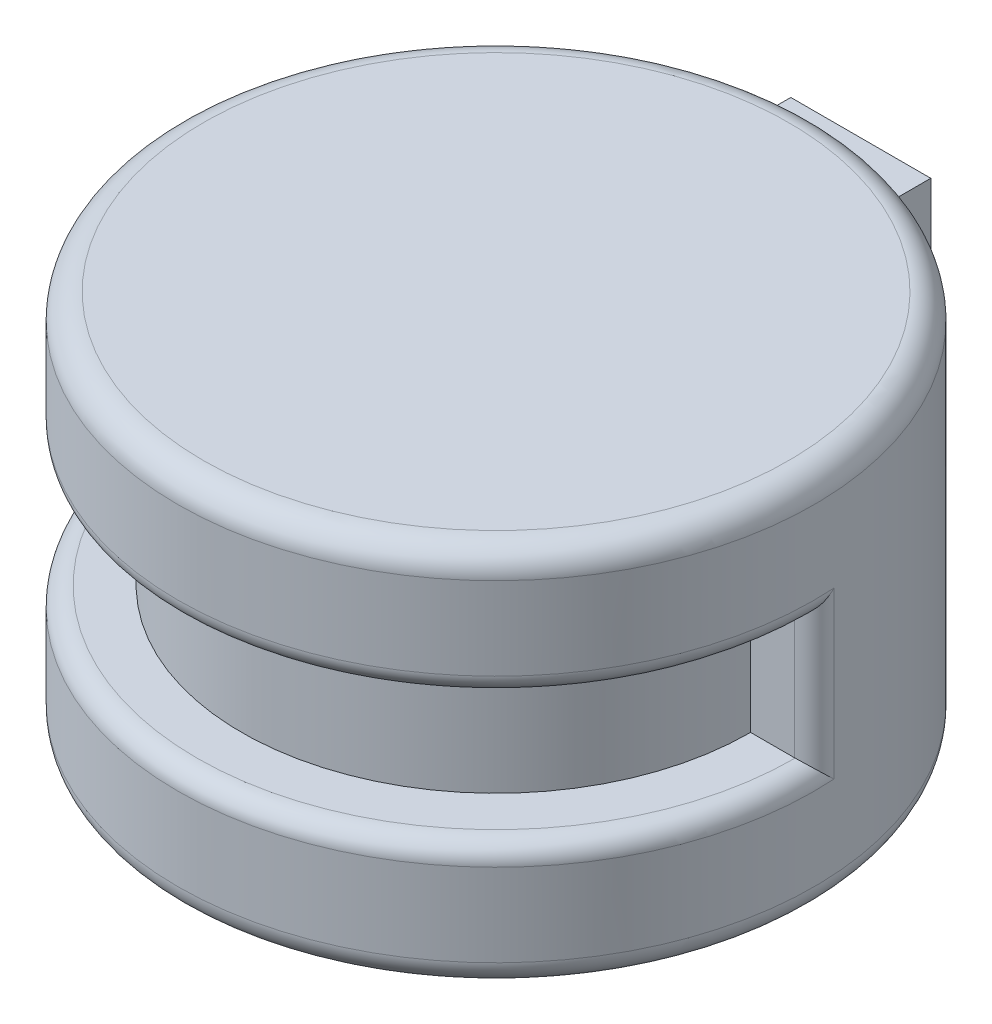
from build123d import *

# Parameters (mm, degrees)
BOSS_EXTRUDE2_DEPTH = 60
BOSS_EXTRUDE3_DEPTH = 20
BOSS_EXTRUDE5_START = -40
BOSS_EXTRUDE5_DEPTH = 20
FILLET2_START       = -43.0000001
FILLET2_OUTLINE_R   = 50
FILLET2_DEPTH       = 3.0000001
FILLET2_START_2     = -20
FILLET2_2_OUTLINE_R = 50
FILLET2_2_DEPTH     = 3.0000001
FILLET2_START_3     = -40
FILLET2_3_DEPTH     = 20
FILLET2_START_4     = -56.0000001
FILLET2_5_DEPTH     = 42.000000197
SKETCH2_W           = 22
SKETCH2_H           = 16
BOSS_EXTRUDE6_DEPTH = 5
SKETCH2_2_W         = 22
SKETCH2_2_H         = 16
BOSS_EXTRUDE7_DEPTH = 7
SCALE6_SCALE        = 0.3


with BuildPart() as part:
    # Sketch1 → Boss-Extrude2 (new body)
    with BuildSketch(Plane(origin=(0, 0, 0), x_dir=(1, 0, 0), z_dir=(0, 1, 0))):
        with BuildLine():
            ThreePointArc((-40, 0), (0, -40), (40, 0))
            Line((40, 0), (50, 0))
            ThreePointArc((50, 0), (0, 50), (-50, 0))
            Line((-50, 0), (-40, 0))
        make_face()
    extrude(amount=-BOSS_EXTRUDE2_DEPTH)

    # Sketch1<4> → Boss-Extrude3 (add)
    with BuildSketch(Plane(origin=(0, 0, 0), x_dir=(1, 0, 0), z_dir=(0, 1, 0))):
        with BuildLine():
            ThreePointArc((-40, 0), (0, -40), (40, 0))
            Line((40, 0), (50, 0))
            ThreePointArc((50, 0), (0, 50), (-50, 0))
            Line((-50, 0), (-40, 0))
        make_face()
        with BuildLine():
            Line((50, 0), (40, 0))
            ThreePointArc((40, 0), (0, -40), (-40, 0))
            Line((-40, 0), (-50, 0))
            ThreePointArc((-50, 0), (0, -50), (50, 0))
        make_face()
    extrude(amount=-BOSS_EXTRUDE3_DEPTH)

    # Sketch1<6> → Boss-Extrude5 (add)
    with BuildSketch(Plane(origin=(0, 0, 0), x_dir=(1, 0, 0), z_dir=(0, 1, 0)).offset(BOSS_EXTRUDE5_START)):
        with BuildLine():
            ThreePointArc((-40, 0), (0, -40), (40, 0))
            Line((40, 0), (50, 0))
            ThreePointArc((50, 0), (0, 50), (-50, 0))
            Line((-50, 0), (-40, 0))
        make_face()
        with BuildLine():
            Line((50, 0), (40, 0))
            ThreePointArc((40, 0), (0, -40), (-40, 0))
            Line((-40, 0), (-50, 0))
            ThreePointArc((-50, 0), (0, -50), (50, 0))
        make_face()
    extrude(amount=-BOSS_EXTRUDE5_DEPTH)

    # Fillet1: read off the stored shape, not the designer's step
    # Fillet1 outline → Fillet1 (revolve, cut)
    with BuildSketch(Plane.XY):
        with BuildLine():
            ThreePointArc((46, 0), (48.828427125, -1.171572875), (50, -4))
            Line((50, -4), (50, 0))
            Line((50, 0), (46, 0))
        make_face()
        with BuildLine():
            Line((50, -60), (50, -56))
            ThreePointArc((50, -56), (48.828427125, -58.828427125), (46, -60))
            Line((46, -60), (50, -60))
        make_face()
    revolve(axis=Axis((0, 0, 0), (0, 1, 0)), mode=Mode.SUBTRACT)

    # Fillet2: read off the stored shape, not the designer's step
    # Fillet2 outline → Fillet2 (cut)
    with BuildSketch(Plane(origin=(0, 0, 0), x_dir=(1, 0, 0), z_dir=(0, 1, 0)).offset(FILLET2_START)):
        Circle(FILLET2_OUTLINE_R)
    extrude(amount=FILLET2_DEPTH, mode=Mode.SUBTRACT)

    # Fillet2 2 outline → Fillet2 2 (cut)
    with BuildSketch(Plane(origin=(0, 0, 0), x_dir=(1, 0, 0), z_dir=(0, 1, 0)).offset(FILLET2_START_2)):
        Circle(FILLET2_2_OUTLINE_R)
    extrude(amount=FILLET2_2_DEPTH, mode=Mode.SUBTRACT)

    # Fillet2 3 outline → Fillet2 3 (cut)
    with BuildSketch(Plane(origin=(0, 0, 0), x_dir=(1, 0, 0), z_dir=(0, 1, 0)).offset(FILLET2_START_3)):
        with BuildLine():
            ThreePointArc((49.898039998, 3.191489362), (49.092132471, 0.947497635), (46.904157598, 0))
            Line((46.904157598, 0), (50, 0))
            ThreePointArc((50, 0), (49.974503499, 1.596558814), (49.898039998, 3.191489362))
        make_face()
        with BuildLine():
            ThreePointArc((-46.904157598, 0), (-49.092132471, 0.947497635), (-49.898039998, 3.191489362))
            ThreePointArc((-49.898039998, 3.191489362), (-49.974503499, 1.596558814), (-50, 0))
            Line((-50, 0), (-46.904157598, 0))
        make_face()
    extrude(amount=FILLET2_3_DEPTH, mode=Mode.SUBTRACT)

    # Fillet2 4 outline → Fillet2 4 (revolve)
    with BuildSketch(Plane.XY):
        with BuildLine():
            Line((0, -17), (0, -20))
            Line((0, -20), (47, -20))
            ThreePointArc((47, -20), (49.121320344, -19.121320344), (50, -17))
            Line((50, -17), (0, -17))
        make_face()
        with BuildLine():
            Line((47, -40), (0, -40))
            Line((0, -40), (0, -43))
            Line((0, -43), (50, -43))
            ThreePointArc((50, -43), (49.121320344, -40.878679656), (47, -40))
        make_face()
    revolve(axis=Axis((0, 0, 0), (0, 1, 0)))

    # Fillet2 5 outline → Fillet2 5 (add)
    with BuildSketch(Plane(origin=(0, 0, 0), x_dir=(1, 0, 0), z_dir=(0, 1, 0)).offset(FILLET2_START_4)):
        with BuildLine():
            ThreePointArc((46.904157598, 0), (49.092132471, 0.947497635), (49.898039998, 3.191489362))
            ThreePointArc((49.898039998, 3.191489362), (0, 50), (-49.898039998, 3.191489362))
            ThreePointArc((-49.898039998, 3.191489362), (-49.092132471, 0.947497635), (-46.904157598, 0))
            Line((-46.904157598, 0), (46.904157598, 0))
        make_face()
    extrude(amount=FILLET2_5_DEPTH)

    # Sketch2 → Boss-Extrude6 (add)
    with BuildSketch(Plane.XY.offset(-50)):
        with Locations((0.314864649, -15.421130919)):
            Rectangle(SKETCH2_W, SKETCH2_H)
    extrude(amount=BOSS_EXTRUDE6_DEPTH)

    # Sketch2<2> → Boss-Extrude7 (add)
    with BuildSketch(Plane.XY.offset(-50)):
        with Locations((0.314864649, -15.421130919)):
            Rectangle(SKETCH2_2_W, SKETCH2_2_H)
    extrude(amount=-BOSS_EXTRUDE7_DEPTH)


with BuildPart() as part_1:
    # Scale6: scaled about (0.002059133, -29.914145752, -2.193081509)
    add(part.part.scale(SCALE6_SCALE).moved(Location((0.001441393, -20.939902026, -1.535157056))))


solid = part_1.part
